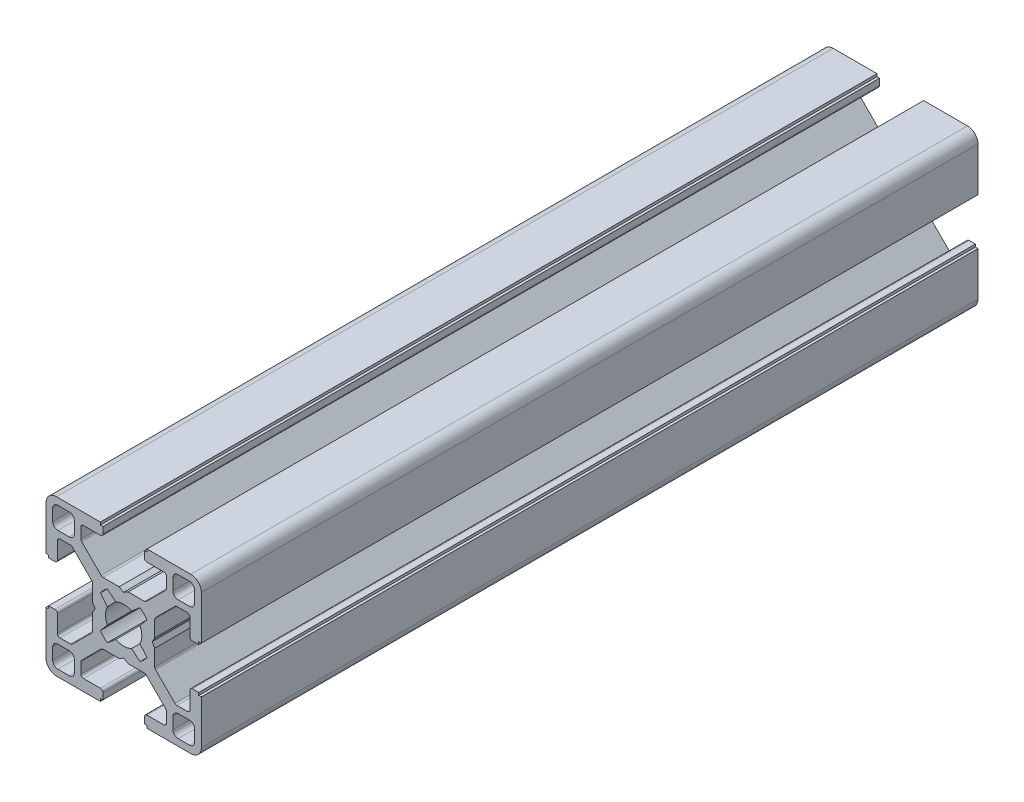
from build123d import *

# Parameters (mm, degrees)
BOSS_EXTRUDE1_DEPTH = 75
CIRPATTERN1_COUNT   = 4


with BuildPart() as part:
    # Sketch3 → Boss-Extrude1 (new, symmetric)
    with BuildSketch(Plane.XY):
        with BuildLine():
            Line((-4.503841895, 3.156803476), (-3.14772708, 1.530298739))
            ThreePointArc((-3.14772708, 1.530298739), (-3.410794979, 0.785160882), (-3.5, 0))
            Line((-3.5, 0), (-5.5, 0))
            Line((-5.5, 0), (-6, 0.866025404))
            Line((-6, 0.866025404), (-6, 3.996841995))
            ThreePointArc((-6, 3.996841995), (-6.038060234, 4.188183711), (-6.146446609, 4.350395385))
            Line((-6.146446609, 4.350395385), (-9.917104615, 8.121053391))
            ThreePointArc((-9.917104615, 8.121053391), (-10.079316289, 8.229439766), (-10.270658005, 8.2675))
            Line((-10.270658005, 8.2675), (-12.29, 8.2675))
            ThreePointArc((-12.29, 8.2675), (-12.643553391, 8.121053391), (-12.79, 7.7675))
            Line((-12.79, 7.7675), (-12.79, 4.5))
            ThreePointArc((-12.79, 4.5), (-12.936446609, 4.146446609), (-13.29, 4))
            Line((-13.29, 4), (-14.5, 4))
            Line((-14.5, 4), (-14.5, 4.5))
            Line((-14.5, 4.5), (-15, 4.5))
            Line((-15, 4.5), (-15, 12.968))
            ThreePointArc((-15, 12.968), (-14.404840979, 14.404840979), (-12.968, 15))
            Line((-12.968, 15), (-4.5, 15))
            Line((-4.5, 15), (-4.5, 14.5))
            Line((-4.5, 14.5), (-4, 14.5))
            Line((-4, 14.5), (-4, 13.29))
            ThreePointArc((-4, 13.29), (-4.146446609, 12.936446609), (-4.5, 12.79))
            Line((-4.5, 12.79), (-7.7675, 12.79))
            ThreePointArc((-7.7675, 12.79), (-8.121053391, 12.643553391), (-8.2675, 12.29))
            Line((-8.2675, 12.29), (-8.2675, 10.270658005))
            ThreePointArc((-8.2675, 10.270658005), (-8.229439766, 10.079316289), (-8.121053391, 9.917104615))
            Line((-8.121053391, 9.917104615), (-4.350395385, 6.146446609))
            ThreePointArc((-4.350395385, 6.146446609), (-4.188183711, 6.038060234), (-3.996841995, 6))
            Line((-3.996841995, 6), (-0.866025404, 6))
            Line((-0.866025404, 6), (0, 5.5))
            Line((0, 5.5), (0, 3.5))
            ThreePointArc((0, 3.5), (-0.785160882, 3.410794979), (-1.530298739, 3.14772708))
            Line((-1.530298739, 3.14772708), (-3.156803476, 4.503841895))
            ThreePointArc((-3.156803476, 4.503841895), (-3.889087297, 3.889087297), (-4.503841895, 3.156803476))
        make_face()
        with BuildLine():
            Line((-12.705, 9.5135), (-10.5135, 9.5135))
            ThreePointArc((-10.5135, 9.5135), (-9.806393219, 9.806393219), (-9.5135, 10.5135))
            Line((-9.5135, 10.5135), (-9.5135, 12.705))
            ThreePointArc((-9.5135, 12.705), (-9.806393219, 13.412106781), (-10.5135, 13.705))
            Line((-10.5135, 13.705), (-12.705, 13.705))
            ThreePointArc((-12.705, 13.705), (-13.412106781, 13.412106781), (-13.705, 12.705))
            Line((-13.705, 12.705), (-13.705, 10.5135))
            ThreePointArc((-13.705, 10.5135), (-13.412106781, 9.806393219), (-12.705, 9.5135))
        make_face(mode=Mode.SUBTRACT)
    boss_extrude1 = extrude(amount=BOSS_EXTRUDE1_DEPTH, both=True)

    # CirPattern1: Boss-Extrude1 ×4 about axis
    cirpattern1_axis = Axis((0, 0, 76.2), (0, 0, -1))
    for i in range(1, CIRPATTERN1_COUNT):
        add(boss_extrude1.rotate(cirpattern1_axis, i * 360 / CIRPATTERN1_COUNT))


solid = part.part
